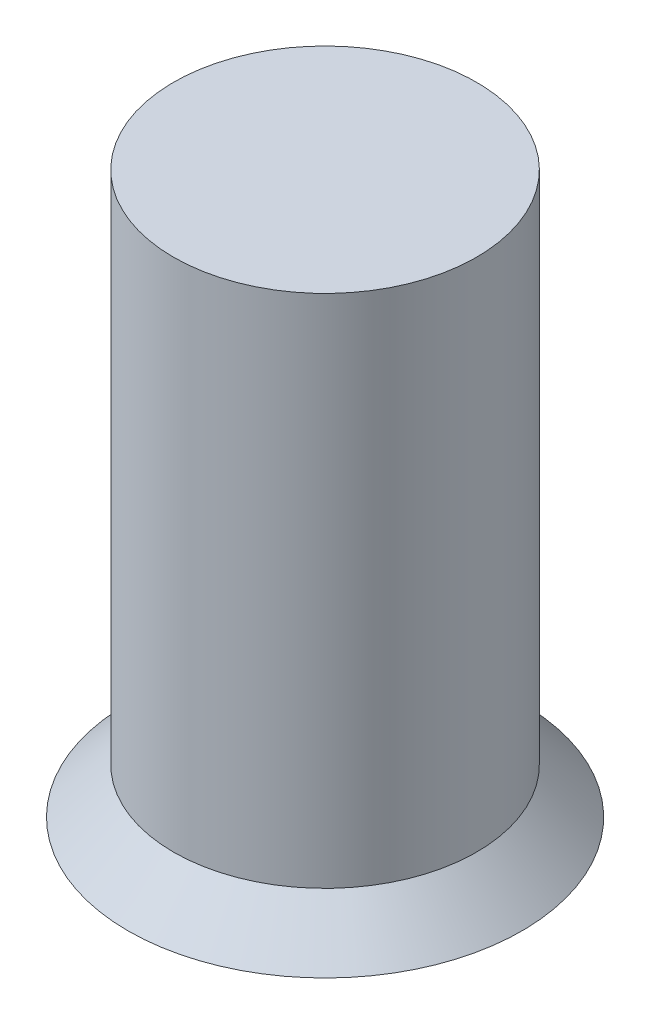
from build123d import *

# Parameters (mm, degrees)
ESQUISSE1_R        = 13
BOSS_EXTRU_3_DEPTH = 3
CHANFREIN2_SIZE    = 3
ESQUISSE3_R        = 10
BOSS_EXTRU_4_DEPTH = 34


with BuildPart() as part:
    # Esquisse1 → Boss.-Extru.3 (new body)
    with BuildSketch(Plane(origin=(0, 0, 0), x_dir=(1, 0, 0), z_dir=(0, 1, 0))):
        with Locations(Location((0, 0, 0), (0, 0, 270))):
            Circle(ESQUISSE1_R)
    extrude(amount=BOSS_EXTRU_3_DEPTH)

    # Chanfrein2
    chanfrein2_edges = [part.edges().sort_by_distance(p)[0] for p in [
        (0, 3, -13),
    ]]
    chamfer(chanfrein2_edges, length=CHANFREIN2_SIZE - 0.0001)  # a hair under: the kernel refuses the full size

    # Esquisse3 → Boss.-Extru.4 (add)
    with BuildSketch(Plane(origin=(0, 3, 0), x_dir=(1, 0, 0), z_dir=(0, 1, 0))):
        with Locations(Location((0, 0, 0), (0, 0, 270))):
            Circle(ESQUISSE3_R)
    extrude(amount=BOSS_EXTRU_4_DEPTH)


solid = part.part
